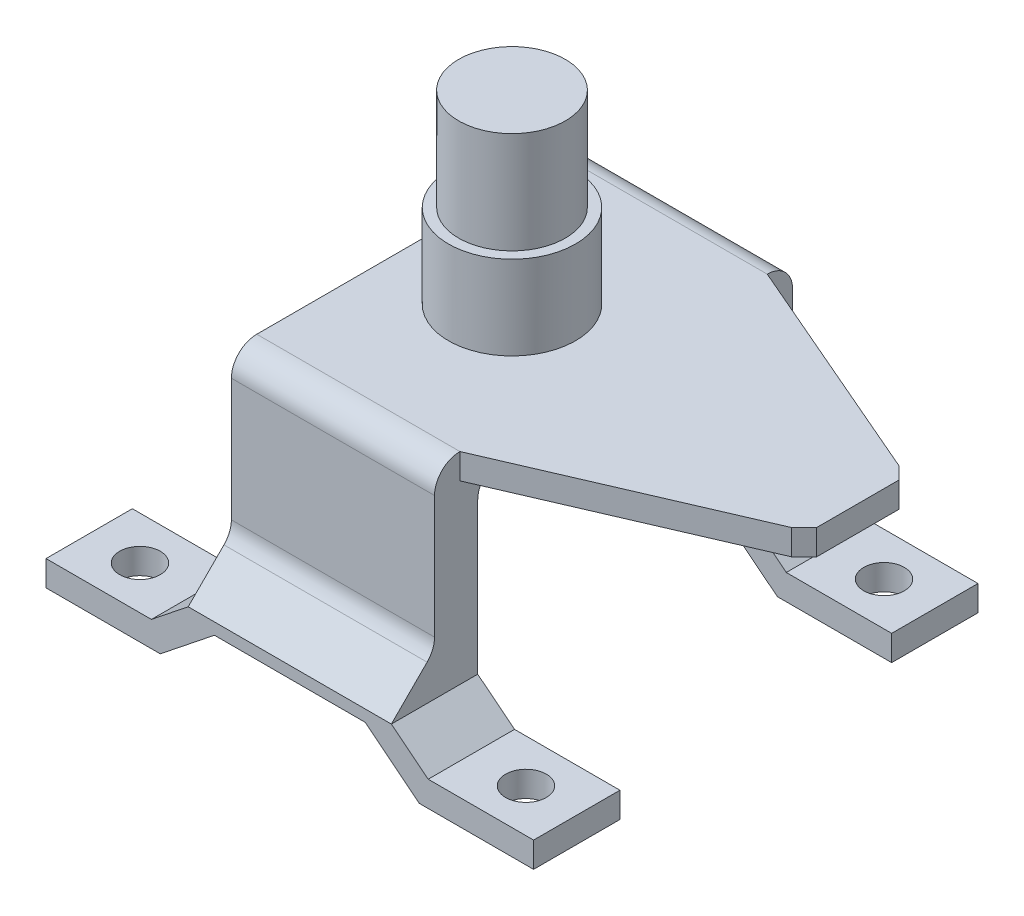
from build123d import *

# Parameters (mm, degrees)
EXTRUDE_1_DEPTH     = 34
OTHER_1_OUTLINE_R   = 8
OTHER_1_DEPTH       = 10
SKETCH_2_W          = 40
SKETCH_2_H          = 10
EXTRUDE_2_DEPTH     = 53.5
CUT_EXTRUDE_1_DEPTH = 145.890475877
FILLET_1_R          = 10
SKETCH_4_R          = 25
EXTRUDE_3_DEPTH     = 33
SKETCH_5_R          = 21
EXTRUDE_4_DEPTH     = 40
EXTRUDE_5_DEPTH     = 10


# Read off the part's stored shape, not the designer's step: Полость1
with BuildPart() as part:
    # Эскиз1 → Бобышка-Вытянуть1 (new body)
    with BuildSketch(Plane.XY):
        Polygon((96, 0), (51, 0), (29.67790849, 17), (0, 17), (0, 101), (40, 101), (40, 21.559615382), (54.498539822, 10), (96, 10), align=None)
    extrude(amount=EXTRUDE_1_DEPTH)

    # Полость1 outline → Полость1 (cut)
    with BuildSketch(Plane(origin=(0, 0, 0), x_dir=(1, 0, 0), z_dir=(0, 1, 0))):
        with Locations((76, -17)):
            Circle(OTHER_1_OUTLINE_R)
    extrude(amount=OTHER_1_DEPTH, mode=Mode.SUBTRACT)

    # Эскиз2 → Бобышка-Вытянуть2 (add)
    with BuildSketch(Plane.XY.offset(34)):
        with Locations((20, 96)):
            Rectangle(SKETCH_2_W, SKETCH_2_H)
    extrude(amount=EXTRUDE_2_DEPTH)

    # Эскиз3 → Вырез-Вытянуть1 (cut, through all)
    with BuildSketch(Plane(origin=(40, 0, 0), x_dir=(0, 0, -1), z_dir=(1, 0, 0))):
        Polygon((0, 101), (-17, 101), (-17, 38.559615382), (0, 21.559615382), align=None)
    extrude(amount=-CUT_EXTRUDE_1_DEPTH, mode=Mode.SUBTRACT)

    # Скругление1
    fillet_1_edges = [part.edges().sort_by_distance(p)[0] for p in [
        (20, 91, 34),
        (20, 38.559615382, 17),
        (20, 101, 17),
    ]]
    fillet(fillet_1_edges, radius=FILLET_1_R)

    # Зеркальное отражение1: part across plane


with BuildPart() as part_1:
    add(part.part)
    add(part.part.mirror(Plane(origin=(0, 17, 173.344895852), x_dir=(0, 0, 1), z_dir=(1, 0, 0))))

    # Зеркальное отражение2: part across plane


with BuildPart() as part_2:
    add(part_1.part)
    add(part_1.part.mirror(Plane(origin=(0, -14, 87.5), x_dir=(1, 0, 0), z_dir=(0, 0, 1))))

    # Эскиз4 → Бобышка-Вытянуть3 (add)
    with BuildSketch(Plane(origin=(0, 101, 0), x_dir=(1, 0, 0), z_dir=(0, 1, 0))):
        with Locations(Location((0, -87.5, 0), (0, 0, 90))):
            Circle(SKETCH_4_R)
    extrude(amount=EXTRUDE_3_DEPTH)

    # Эскиз5 → Бобышка-Вытянуть4 (add)
    with BuildSketch(Plane(origin=(0, 134, 0), x_dir=(1, 0, 0), z_dir=(0, 1, 0))):
        with Locations(Location((0, -87.5, 0), (0, 0, 180))):
            Circle(SKETCH_5_R)
    extrude(amount=EXTRUDE_4_DEPTH)

    # Эскиз6 → Бобышка-Вытянуть5 (add)
    with BuildSketch(Plane(origin=(0, 101, 0), x_dir=(1, 0, 0), z_dir=(0, 1, 0))):
        Polygon((131.15, -108.65), (136.15, -103.65), (136.15, -71.35), (131.15, -66.35), (40, -27), (40, -148), align=None)
    extrude(amount=-EXTRUDE_5_DEPTH)


solid = part_2.part
